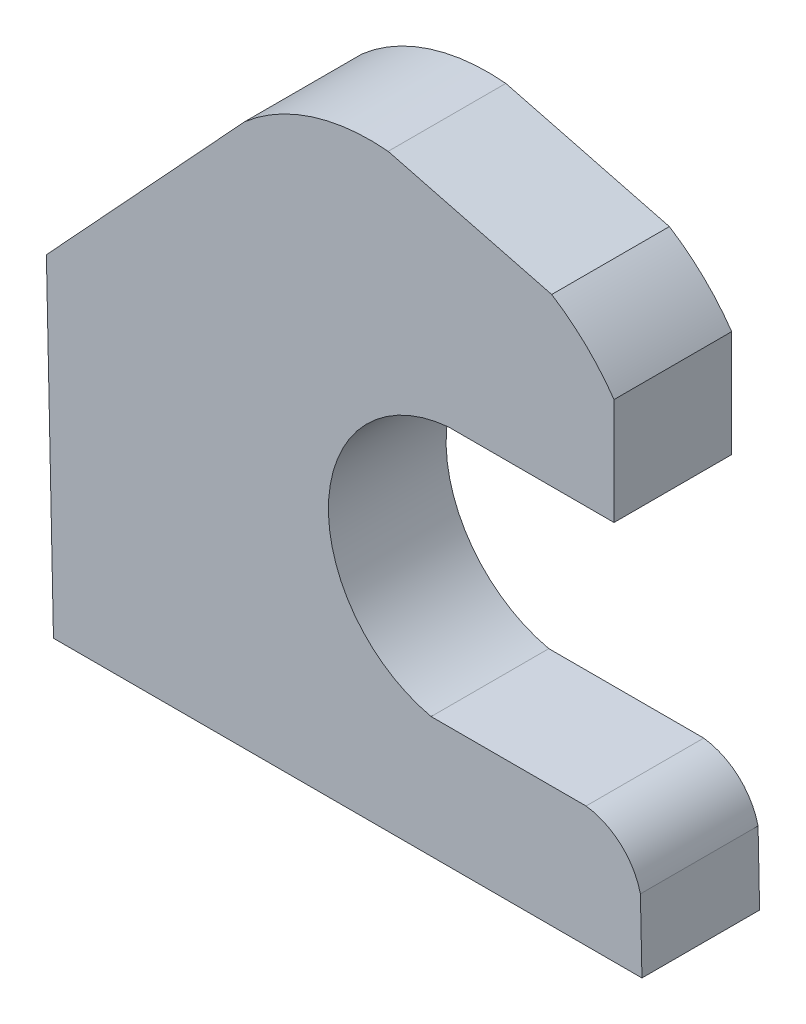
from build123d import *

# Parameters (mm, degrees)
TABAN_FLAN_1_DEPTH         = 50
KES_EKSTR_ZYON1_DEPTH      = 585.997809561
KES_EKSTR_ZYON1_DEPTH_BACK = 585.997809561


# Sheet-metal steps are written as plain solids
with BuildPart() as part:
    # Çizim1 → Taban-Flanş1 (new body)
    with BuildSketch(Plane.XY):
        with BuildLine():
            Line((0, 0), (218.5, 0))
            ThreePointArc((218.5, 0), (276, 50), (333.5, 0))
            Line((333.5, 0), (360, 0))
            Line((360, 0), (449, 0))
            Line((449, 0), (458.997671741, 0.215777088))
            Line((458.997671741, 0.215777088), (455.997671741, 139.215777088))
            ThreePointArc((455.997671741, 139.215777088), (447.698955646, 153.213358252), (432.909011054, 160))
            Line((432.909011054, 160), (367.081412811, 160))
            ThreePointArc((367.081412811, 160), (323.554697394, 218.317011668), (374.513743955, 270.265297284))
            Line((374.513743955, 270.265297284), (434.798113421, 270.265297284))
            Line((434.798113421, 270.265297284), (444.798113421, 270.265297284))
            Line((444.798113421, 270.265297284), (444.798113421, 315.516988045))
            ThreePointArc((444.798113421, 315.516988045), (432.826102146, 329.550683033), (418.309236409, 340.931994828))
            Line((418.309236409, 340.931994828), (348.808103312, 358.867771111))
            ThreePointArc((348.808103312, 358.867771111), (316.270646866, 355.31487857), (287.772711056, 339.215910531))
            Line((287.772711056, 339.215910531), (171.828858079, 213.879290682))
            ThreePointArc((171.828858079, 213.879290682), (144.61514494, 194.164293468), (113.814091907, 180.726941422))
            ThreePointArc((113.814091907, 180.726941422), (82.931673061, 178.777598724), (53.149679292, 187.177395023))
            Line((53.149679292, 187.177395023), (53.149679292, 80.862415296))
            Line((53.149679292, 80.862415296), (0, 0))
        make_face()
    extrude(amount=TABAN_FLAN_1_DEPTH)

    # Çizim2 → Kes-Ekstrüzyon1 (cut, two sides: drawn at the far end of the back side and taken through both)
    with BuildSketch(Plane.XY.offset(50).offset(-KES_EKSTR_ZYON1_DEPTH_BACK)):
        with BuildLine():
            Line((456.658866876, 108.580402505), (206.600646856, 108.580402505))
            Line((206.600646856, 108.580402505), (203.587052823, 248.210259333))
            Line((203.587052823, 248.210259333), (171.828858079, 213.879290682))
            ThreePointArc((171.828858079, 213.879290682), (144.61514494, 194.164293468), (113.814091907, 180.726941422))
            ThreePointArc((113.814091907, 180.726941422), (82.931673061, 178.777598724), (53.149679292, 187.177395023))
            Line((53.149679292, 187.177395023), (53.149679292, 80.862415296))
            Line((53.149679292, 80.862415296), (0, 0))
            Line((0, 0), (218.5, 0))
            ThreePointArc((218.5, 0), (276, 50), (333.5, 0))
            Line((333.5, 0), (449, 0))
            Line((449, 0), (458.997671741, 0.215777088))
            Line((458.997671741, 0.215777088), (456.658866876, 108.580402505))
        make_face()
    extrude(amount=KES_EKSTR_ZYON1_DEPTH + KES_EKSTR_ZYON1_DEPTH_BACK, mode=Mode.SUBTRACT)


solid = part.part
